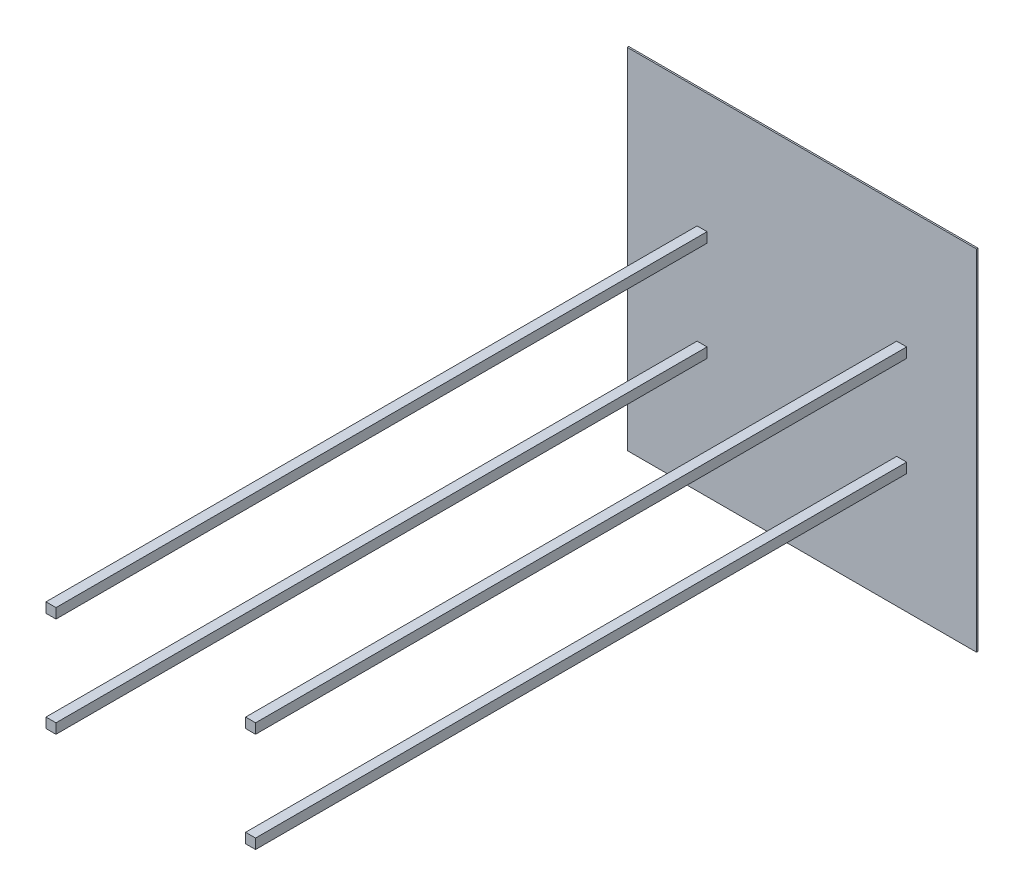
from build123d import *

# Parameters (mm, degrees)
SCHIZZO1_W                       = 700
SCHIZZO1_H                       = 700
ESTRUSIONE_ESTRUSIONE1_DEPTH     = 3
SCHIZZO2_W                       = 20
SCHIZZO2_H                       = 20
ESTRUSIONE_ESTRUSIONE2_DEPTH     = 1305
RIPETIZIONE_A_L1_COUNT           = 2
RIPETIZIONE_A_L1_PITCH           = 400
RIPETIZIONE_A_L2_COPY_1_SKETCH_W = 20
RIPETIZIONE_A_L2_COPY_1_SKETCH_H = 20
RIPETIZIONE_A_L2_COPY_1_DEPTH    = 1305
RIPETIZIONE_A_L2_COPY_2_SKETCH_W = 20
RIPETIZIONE_A_L2_COPY_2_SKETCH_H = 20
RIPETIZIONE_A_L2_COPY_2_DEPTH    = 1305


with BuildPart() as part:
    # Schizzo1 → Estrusione-Estrusione1 (new body)
    with BuildSketch(Plane.XY):
        Rectangle(SCHIZZO1_W, SCHIZZO1_H)
    extrude(amount=ESTRUSIONE_ESTRUSIONE1_DEPTH)

    # Schizzo2 → Estrusione-Estrusione2 (add)
    with BuildSketch(Plane.XY.offset(3)):
        with Locations((-200, 100)):
            Rectangle(SCHIZZO2_W, SCHIZZO2_H)
    estrusione_estrusione2 = extrude(amount=ESTRUSIONE_ESTRUSIONE2_DEPTH)

    # Ripetizione a L1: Estrusione-Estrusione2 ×2
    with Locations(*[(i * RIPETIZIONE_A_L1_PITCH, 0, 0) for i in range(1, RIPETIZIONE_A_L1_COUNT)]):
        add(estrusione_estrusione2)

    # Ripetizione a L2 copy 1 sketch → Ripetizione a L2 copy 1 (add)
    with BuildSketch(Plane(origin=(400, -200, 3), x_dir=(1, 0, 0), z_dir=(0, 0, 1))):
        with Locations((-200, 100)):
            Rectangle(RIPETIZIONE_A_L2_COPY_1_SKETCH_W, RIPETIZIONE_A_L2_COPY_1_SKETCH_H)
    extrude(amount=RIPETIZIONE_A_L2_COPY_1_DEPTH)

    # Ripetizione a L2 copy 2 sketch → Ripetizione a L2 copy 2 (add)
    with BuildSketch(Plane(origin=(0, -200, 3), x_dir=(1, 0, 0), z_dir=(0, 0, 1))):
        with Locations((-200, 100)):
            Rectangle(RIPETIZIONE_A_L2_COPY_2_SKETCH_W, RIPETIZIONE_A_L2_COPY_2_SKETCH_H)
    extrude(amount=RIPETIZIONE_A_L2_COPY_2_DEPTH)


solid = part.part
